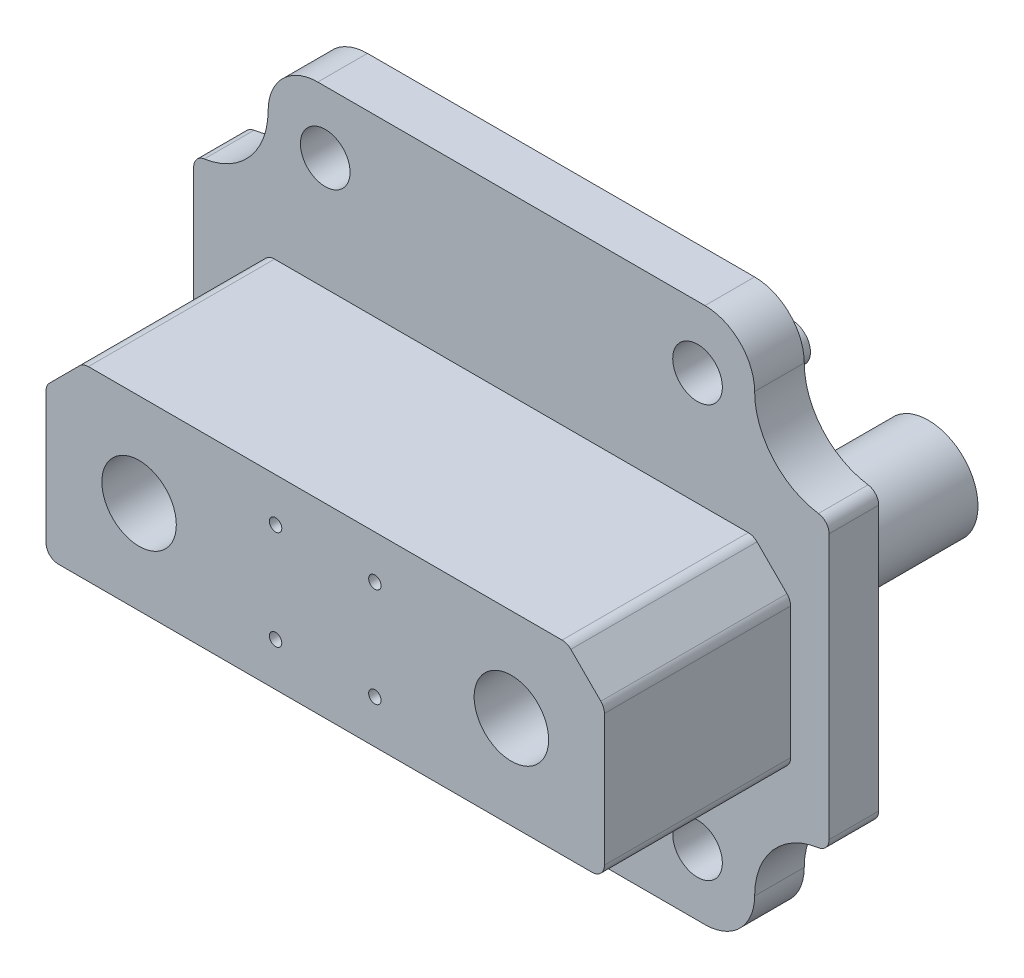
from build123d import *

# Parameters (mm, degrees)
EXTRUDE_1_DEPTH     = 2
SKETCH_2_R          = 1
CUT_EXTRUDE_1_DEPTH = 2
EXTRUDE_2_DEPTH     = 7.5
SKETCH_4_R          = 1.5
SKETCH_4_R_2        = 0.25
CUT_EXTRUDE_2_DEPTH = 7.5
SKETCH_5_W          = 21
SKETCH_5_H          = 7.5
EXTRUDE_3_DEPTH     = 1.7
SKETCH_6_R          = 2
SKETCH_6_R_2        = 0.75
EXTRUDE_4_DEPTH     = 5.6
FILLET_1_R          = 2
FILLET_2_R          = 3
FILLET_3_R          = 1
FILLET_4_R          = 0.5


with BuildPart() as part:
    # 草图1 → 凸台-拉伸1 (new body)
    with BuildSketch(Plane.XY):
        Polygon((0, 10.8), (-9.8, 10.8), (-9.8, 5.8), (-12.8, 5.8), (-12.8, -5.8), (-9.8, -5.8), (-9.8, -10.8), (0, -10.8), (9.8, -10.8), (9.8, -5.8), (12.8, -5.8), (12.8, 5.8), (9.8, 5.8), (9.8, 10.8), align=None)
    extrude(amount=EXTRUDE_1_DEPTH)

    # 草图2 → 切除-拉伸1 (cut)
    with BuildSketch(Plane.XY.offset(2)):
        with Locations((-7.5, 8.3)):
            Circle(SKETCH_2_R)
        with Locations(Location((7.5, 8.3, 0), (0, 0, 180))):
            Circle(SKETCH_2_R)
        with Locations((7.5, -8.3)):
            Circle(SKETCH_2_R)
        with Locations(Location((-7.5, -8.3, 0), (0, 0, 180))):
            Circle(SKETCH_2_R)
    extrude(amount=-CUT_EXTRUDE_1_DEPTH, mode=Mode.SUBTRACT)

    # 草图3 → 凸台-拉伸2 (add)
    with BuildSketch(Plane.XY.offset(2)):
        Polygon((11.25, -3.75), (-11.25, -3.75), (-11.25, 2.25), (-9.75, 3.75), (9.75, 3.75), (11.25, 2.25), align=None)
    extrude(amount=EXTRUDE_2_DEPTH)

    # 草图4 → 切除-拉伸2 (cut)
    with BuildSketch(Plane.XY.offset(9.5)):
        with Locations((-7.5, 0)):
            Circle(SKETCH_4_R)
        with Locations((-2, 2)):
            Circle(SKETCH_4_R_2)
        with Locations(Location((2, 2, 0), (0, 0, 180))):
            Circle(SKETCH_4_R_2)
        with Locations((7.5, 0)):
            Circle(SKETCH_4_R)
        with Locations((2, -2)):
            Circle(SKETCH_4_R_2)
        with Locations(Location((-2, -2, 0), (0, 0, 180))):
            Circle(SKETCH_4_R_2)
    extrude(amount=-CUT_EXTRUDE_2_DEPTH, mode=Mode.SUBTRACT)

    # 草图5 → 凸台-拉伸3 (add)
    with BuildSketch(Plane(origin=(0, 0, 0), x_dir=(-1, 0, 0), z_dir=(0, 0, -1))):
        Rectangle(SKETCH_5_W, SKETCH_5_H)
    extrude(amount=EXTRUDE_3_DEPTH)

    # 草图6 → 凸台-拉伸4 (add)
    with BuildSketch(Plane(origin=(0, 0, -1.7), x_dir=(-1, 0, 0), z_dir=(0, 0, -1))):
        with Locations(Location((-7.5, 0, 0), (0, 0, 180))):
            Circle(SKETCH_6_R)
        with Locations(Location((-2, 2, 0), (0, 0, 180))):
            Circle(SKETCH_6_R_2)
        with Locations(Location((2, 2, 0), (0, 0, 180))):
            Circle(SKETCH_6_R_2)
        with Locations(Location((7.5, 0, 0), (0, 0, 180))):
            Circle(SKETCH_6_R)
        with Locations(Location((2, -2, 0), (0, 0, 180))):
            Circle(SKETCH_6_R_2)
        with Locations(Location((-2, -2, 0), (0, 0, 180))):
            Circle(SKETCH_6_R_2)
    extrude(amount=EXTRUDE_4_DEPTH)

    # 圆角1
    fillet_1_edges = [part.edges().sort_by_distance(p)[0] for p in [
        (9.8, 10.8, 1),
        (9.8, -10.8, 1),
        (-9.8, -10.8, 1),
        (-9.8, 10.8, 1),
    ]]
    fillet(fillet_1_edges, radius=FILLET_1_R)

    # 圆角2
    fillet_2_edges = [part.edges().sort_by_distance(p)[0] for p in [
        (-9.8, -5.8, 1),
        (9.8, -5.8, 1),
        (-9.8, 5.8, 1),
        (9.8, 5.8, 1),
    ]]
    fillet(fillet_2_edges, radius=FILLET_2_R - 0.0001)  # a hair under: the kernel refuses the full size

    # 圆角3
    fillet_3_edges = [part.edges().sort_by_distance(p)[0] for p in [
        (-10.5, -3.75, -0.85),
        (-10.5, 3.75, -0.85),
        (10.5, 3.75, -0.85),
        (10.5, -3.75, -0.85),
    ]]
    fillet(fillet_3_edges, radius=FILLET_3_R)

    # 圆角4
    fillet_4_edges = [part.edges().sort_by_distance(p)[0] for p in [
        (12.8, 5.8, 1),
        (12.8, -5.8, 1),
        (-12.8, -5.8, 1),
        (-12.8, 5.8, 1),
        (11.25, 2.25, 5.75),
        (9.75, 3.75, 5.75),
        (-9.75, 3.75, 5.75),
        (-11.25, 2.25, 5.75),
        (-11.25, -3.75, 5.75),
        (11.25, -3.75, 5.75),
    ]]
    fillet(fillet_4_edges, radius=FILLET_4_R)


solid = part.part
